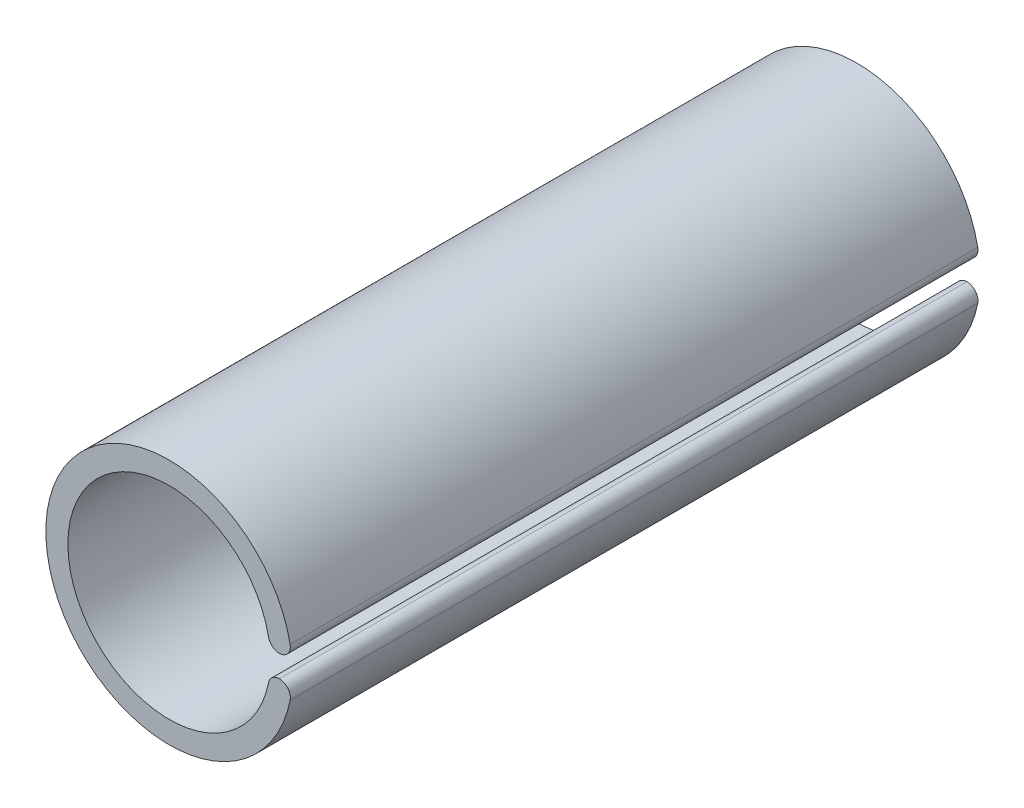
from build123d import *

# Parameters (mm, degrees)
SKETCH_1_R          = 5.6
SKETCH_1_R_2        = 4.6
EXTRUDE_1_DEPTH     = 31.22
SKETCH_2_W          = 4.086350381
SKETCH_2_H          = 1
CUT_EXTRUDE_1_DEPTH = 33.208824878
FILLET_1_R          = 0.5


with BuildPart() as part:
    # 스케치1 → 보스-돌출1 (new body)
    with BuildSketch(Plane.XY):
        Circle(SKETCH_1_R)
        Circle(SKETCH_1_R_2, mode=Mode.SUBTRACT)
    extrude(amount=EXTRUDE_1_DEPTH)

    # 스케치2 → 컷-돌출1 (cut, through all)
    with BuildSketch(Plane.XY):
        with Locations((5.169276946, 0)):
            Rectangle(SKETCH_2_W, SKETCH_2_H)
    extrude(amount=CUT_EXTRUDE_1_DEPTH, mode=Mode.SUBTRACT)

    # 필렛1
    fillet_1_edges = [part.edges().sort_by_distance(p)[0] for p in [
        (4.572745346, -0.5, 15.61),
        (5.577633907, -0.5, 15.61),
        (5.577633907, 0.5, 15.61),
        (4.572745346, 0.5, 15.61),
    ]]
    fillet(fillet_1_edges, radius=FILLET_1_R - 0.0001)  # a hair under: the kernel refuses the full size


solid = part.part
